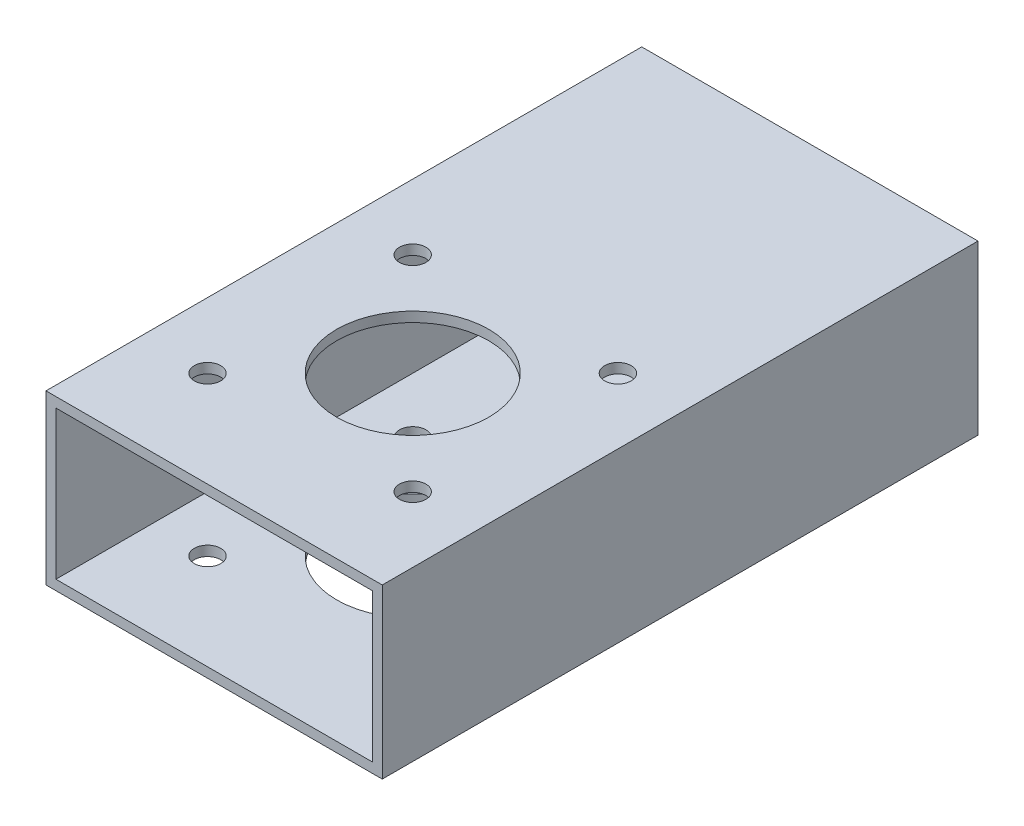
from build123d import *

# Parameters (mm, degrees)
CROQUIS1_W              = 50.8
CROQUIS1_H              = 25.4
CROQUIS1_W_2            = 47.8
CROQUIS1_H_2            = 22.4
SALIENTE_EXTRUIR1_DEPTH = 90
CROQUIS2_R              = 11.5
CROQUIS2_R_2            = 2
CORTAR_EXTRUIR1_DEPTH   = 26


with BuildPart() as part:
    # Croquis1 → Saliente-Extruir1 (new body)
    with BuildSketch(Plane.XY):
        Rectangle(CROQUIS1_W, CROQUIS1_H)
        Rectangle(CROQUIS1_W_2, CROQUIS1_H_2, mode=Mode.SUBTRACT)
    extrude(amount=SALIENTE_EXTRUIR1_DEPTH)

    # Croquis2 → Cortar-Extruir1 (cut)
    with BuildSketch(Plane(origin=(0, -12.7, 0), x_dir=(-1, 0, 0), z_dir=(0, -1, 0))):
        with Locations((0, -60)):
            Circle(CROQUIS2_R)
        with Locations((15.5, -75.5)):
            Circle(CROQUIS2_R_2)
        with Locations((-15.5, -75.5)):
            Circle(CROQUIS2_R_2)
        with Locations((-15.5, -44.5)):
            Circle(CROQUIS2_R_2)
        with Locations((15.5, -44.5)):
            Circle(CROQUIS2_R_2)
    extrude(amount=-CORTAR_EXTRUIR1_DEPTH, mode=Mode.SUBTRACT)


solid = part.part
